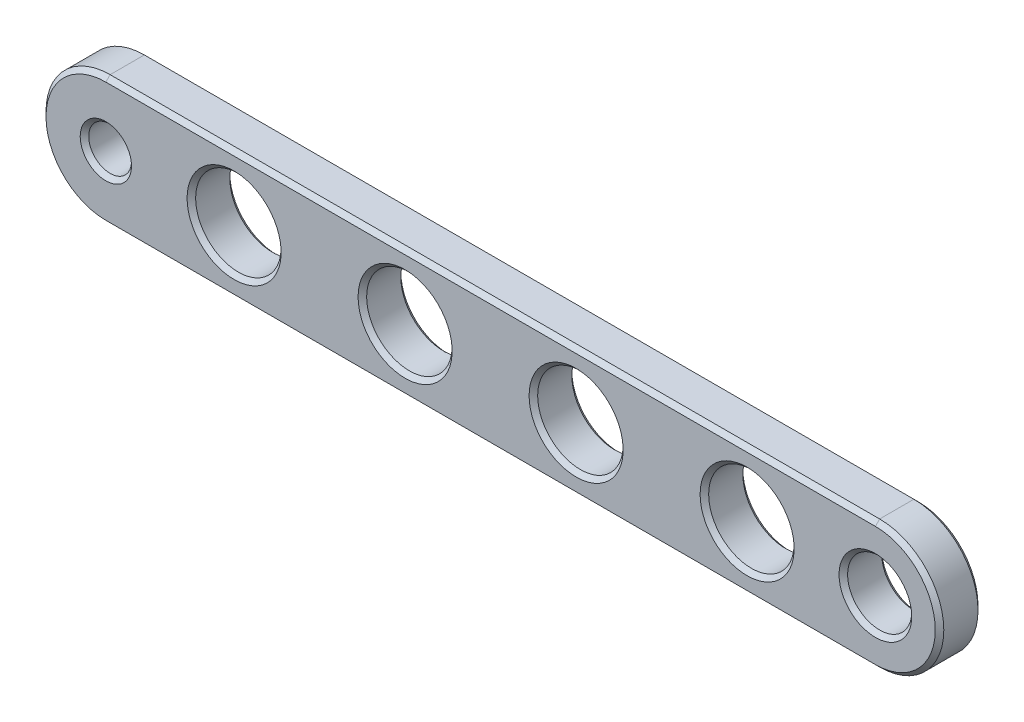
from build123d import *

# Parameters (mm, degrees)
SKETCH1_R           = 1
SKETCH1_R_2         = 1.5
SKETCH1_R_3         = 2
BOSS_EXTRUDE1_DEPTH = 2
CHAMFER1_SIZE       = 0.2


with BuildPart() as part:
    # Sketch1 → Boss-Extrude1 (new body)
    with BuildSketch(Plane.XY):
        with BuildLine():
            Line((-17.346835443, 3), (18.653164557, 3))
            ThreePointArc((18.653164557, 3), (21.653164557, 0), (18.653164557, -3))
            Line((18.653164557, -3), (-17.346835443, -3))
            ThreePointArc((-17.346835443, -3), (-20.346835443, 0), (-17.346835443, 3))
        make_face()
        with Locations((-17.346835443, 0)):
            Circle(SKETCH1_R, mode=Mode.SUBTRACT)
        with Locations((18.653164557, 0)):
            Circle(SKETCH1_R_2, mode=Mode.SUBTRACT)
        with Locations((-11.346835443, 0)):
            Circle(SKETCH1_R_3, mode=Mode.SUBTRACT)
        with Locations((-3.346835443, 0)):
            Circle(SKETCH1_R_3, mode=Mode.SUBTRACT)
        with Locations((4.653164557, 0)):
            Circle(SKETCH1_R_3, mode=Mode.SUBTRACT)
        with Locations((12.653164557, 0)):
            Circle(SKETCH1_R_3, mode=Mode.SUBTRACT)
    extrude(amount=BOSS_EXTRUDE1_DEPTH)

    # Chamfer1
    chamfer1_edges = [part.edges().sort_by_distance(p)[0] for p in [
        (10.653164557, 0, 0),
        (-5.346835443, 0, 0),
        (17.153164557, 0, 0),
        (0.653164557, 3, 0),
        (-20.346835443, 0, 0),
        (0.653164557, -3, 0),
        (21.653164557, 0, 0),
        (-18.346835443, 0, 0),
        (-13.346835443, 0, 0),
        (2.653164557, 0, 0),
        (10.653164557, 0, 2),
        (2.653164557, 0, 2),
        (-5.346835443, 0, 2),
        (-13.346835443, 0, 2),
        (17.153164557, 0, 2),
        (-18.346835443, 0, 2),
        (0.653164557, -3, 2),
        (-20.346835443, 0, 2),
        (0.653164557, 3, 2),
        (21.653164557, 0, 2),
    ]]
    chamfer(chamfer1_edges, length=CHAMFER1_SIZE)


solid = part.part
